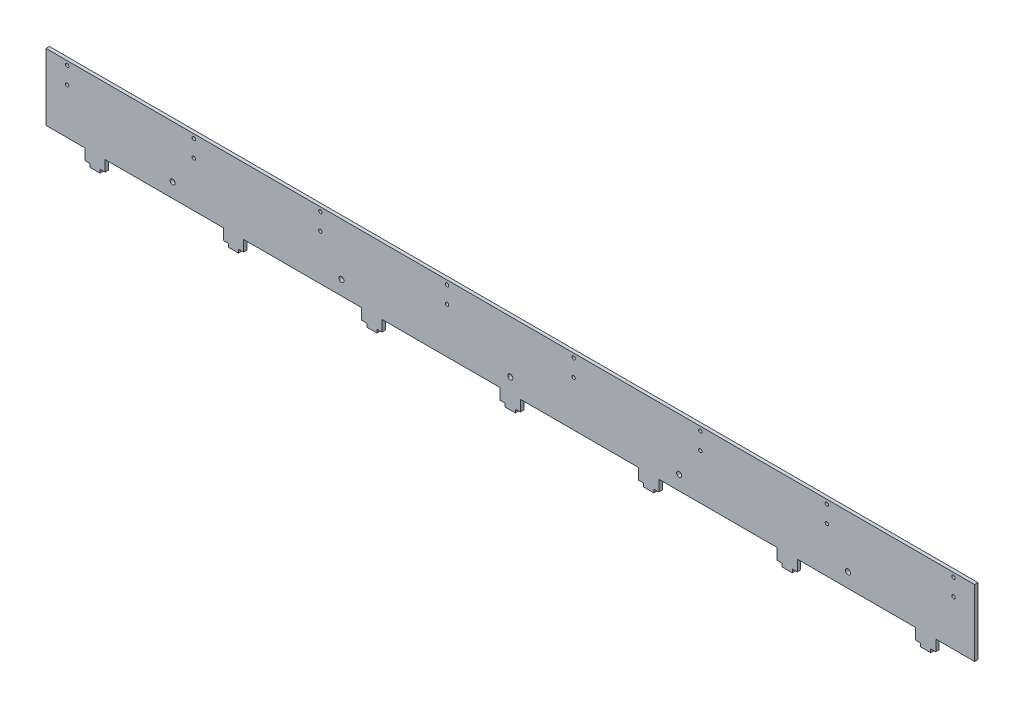
from build123d import *

# Parameters (mm, degrees)
SKETCH_1_W             = 1100
SKETCH_1_H             = 92
EXTRUDE_1_DEPTH        = 2
SKETCH_2_W             = 46
SKETCH_2_H             = 13
SKETCH_2_W_2           = 140
CUT_EXTRUDE_1_DEPTH    = 552.934778756
SKETCH_3_R             = 2
CUT_EXTRUDE_2_DEPTH    = 552.934778756
PATTERN_LINEAR_1_COUNT = 8
PATTERN_LINEAR_1_PITCH = 150
SKETCH_4_R             = 3
CUT_EXTRUDE_3_DEPTH    = 552.934778756
PATTERN_LINEAR_2_COUNT = 5
PATTERN_LINEAR_2_PITCH = 200
SKETCH_5_W             = 12
SKETCH_5_H             = 4
EXTRUDE_2_DEPTH        = 4


with BuildPart() as part:
    # Эскиз1 → Бобышка-Вытянуть1 (new, symmetric)
    with BuildSketch(Plane.XY):
        Rectangle(SKETCH_1_W, SKETCH_1_H)
    extrude(amount=EXTRUDE_1_DEPTH, both=True)

    # Эскиз2 → Вырез-Вытянуть1 (cut, through all)
    with BuildSketch(Plane.XY.offset(2)):
        with Locations((-527, -39.5)):
            Rectangle(SKETCH_2_W, SKETCH_2_H)
        with Locations((527, -39.5)):
            Rectangle(SKETCH_2_W, SKETCH_2_H)
        with Locations((-410, -39.5)):
            Rectangle(SKETCH_2_W_2, SKETCH_2_H)
        with Locations((-246, -39.5)):
            Rectangle(SKETCH_2_W_2, SKETCH_2_H)
        with Locations((-82, -39.5)):
            Rectangle(SKETCH_2_W_2, SKETCH_2_H)
        with Locations((82, -39.5)):
            Rectangle(SKETCH_2_W_2, SKETCH_2_H)
        with Locations((246, -39.5)):
            Rectangle(SKETCH_2_W_2, SKETCH_2_H)
        with Locations((410, -39.5)):
            Rectangle(SKETCH_2_W_2, SKETCH_2_H)
    extrude(amount=-CUT_EXTRUDE_1_DEPTH, mode=Mode.SUBTRACT)

    # Эскиз3 → Вырез-Вытянуть2 (cut, through all)
    with BuildSketch(Plane.XY.offset(2)):
        with Locations((-525, 41)):
            Circle(SKETCH_3_R)
        with Locations((-525, 21)):
            Circle(SKETCH_3_R)
    cut_extrude_2 = extrude(amount=-CUT_EXTRUDE_2_DEPTH, mode=Mode.SUBTRACT)

    # Линейный массив1: Вырез-Вытянуть2 ×8
    with Locations(*[(i * PATTERN_LINEAR_1_PITCH, 0, 0) for i in range(1, PATTERN_LINEAR_1_COUNT)]):
        add(cut_extrude_2, mode=Mode.SUBTRACT)

    # Эскиз4 → Вырез-Вытянуть3 (cut, through all)
    with BuildSketch(Plane(origin=(0, 0, -2), x_dir=(-1, 0, 0), z_dir=(0, 0, -1))):
        with Locations((-400, -16)):
            Circle(SKETCH_4_R)
    cut_extrude_3 = extrude(amount=-CUT_EXTRUDE_3_DEPTH, mode=Mode.SUBTRACT)

    # Линейный массив2: Вырез-Вытянуть3 ×5
    with Locations(*[(-i * PATTERN_LINEAR_2_PITCH, 0, 0) for i in range(1, PATTERN_LINEAR_2_COUNT)]):
        add(cut_extrude_3, mode=Mode.SUBTRACT)

    # Эскиз5 → Бобышка-Вытянуть2 (add)
    with BuildSketch(Plane.XZ.offset(46)):
        with Locations((492, 0)):
            Rectangle(SKETCH_5_W, SKETCH_5_H)
        with Locations((328, 0)):
            Rectangle(SKETCH_5_W, SKETCH_5_H)
        with Locations((164, 0)):
            Rectangle(SKETCH_5_W, SKETCH_5_H)
        Rectangle(SKETCH_5_W, SKETCH_5_H)
        with Locations((-492, 0)):
            Rectangle(SKETCH_5_W, SKETCH_5_H)
        with Locations((-328, 0)):
            Rectangle(SKETCH_5_W, SKETCH_5_H)
        with Locations((-164, 0)):
            Rectangle(SKETCH_5_W, SKETCH_5_H)
    extrude(amount=EXTRUDE_2_DEPTH)


solid = part.part
